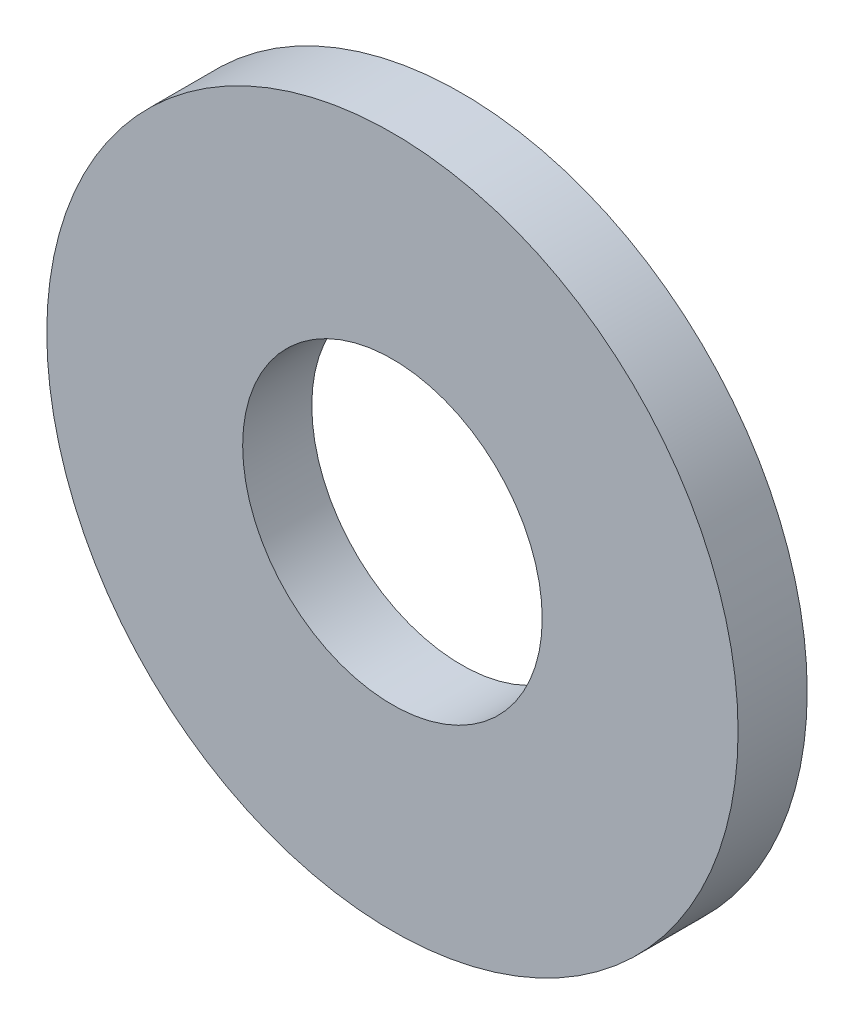
from build123d import *

# Parameters (mm, degrees)
SKETCH1_R           = 6
SKETCH1_R_2         = 2.6
BOSS_EXTRUDE1_DEPTH = 1.2


with BuildPart() as part:
    # Sketch1 → Boss-Extrude1 (new body)
    with BuildSketch(Plane.XY):
        Circle(SKETCH1_R)
        Circle(SKETCH1_R_2, mode=Mode.SUBTRACT)
    extrude(amount=BOSS_EXTRUDE1_DEPTH)


solid = part.part
